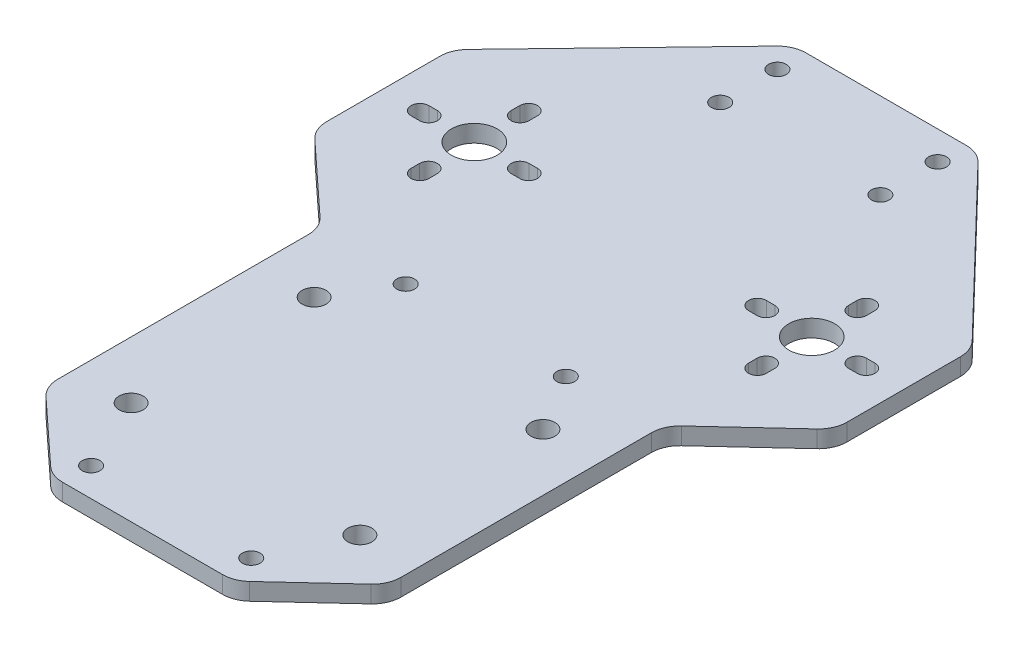
from build123d import *

# Parameters (mm, degrees)
SKETCH1_W           = 91
SKETCH1_H           = 130
SKETCH1_R           = 1.55
SKETCH1_R_2         = 2.1
SKETCH1_R_3         = 4
EXTRUDE_1_DEPTH     = 3
CUT_EXTRUDE_1_REACH = 100.669
FILLET_1_R          = 5


with BuildPart() as part:
    # Sketch1 → 凸台-拉伸1 (new body)
    with BuildSketch(Plane(origin=(0, 0, 0), x_dir=(1, 0, 0), z_dir=(0, 1, 0))):
        with Locations((0, -22.5)):
            Rectangle(SKETCH1_W, SKETCH1_H)
        with Locations((-14, -82.5)):
            Circle(SKETCH1_R, mode=Mode.SUBTRACT)
        with Locations((-20, -69.5)):
            Circle(SKETCH1_R_2, mode=Mode.SUBTRACT)
        with Locations((-20, -37.5)):
            Circle(SKETCH1_R_2, mode=Mode.SUBTRACT)
        with Locations((-14, -27.5)):
            Circle(SKETCH1_R, mode=Mode.SUBTRACT)
        with Locations((14, -82.5)):
            Circle(SKETCH1_R, mode=Mode.SUBTRACT)
        with Locations((20, -69.5)):
            Circle(SKETCH1_R_2, mode=Mode.SUBTRACT)
        with Locations((20, -37.5)):
            Circle(SKETCH1_R_2, mode=Mode.SUBTRACT)
        with Locations((14, -27.5)):
            Circle(SKETCH1_R, mode=Mode.SUBTRACT)
        with BuildLine():
            Line((-31.05, -9.5), (-31.05, -8))
            ThreePointArc((-31.05, -8), (-29.5, -6.45), (-27.95, -8))
            Line((-27.95, -8), (-27.95, -9.5))
            ThreePointArc((-27.95, -9.5), (-29.5, -11.05), (-31.05, -9.5))
        make_face(mode=Mode.SUBTRACT)
        with BuildLine():
            Line((-39, 1.55), (-37.5, 1.55))
            ThreePointArc((-37.5, 1.55), (-35.95, 0), (-37.5, -1.55))
            Line((-37.5, -1.55), (-39, -1.55))
            ThreePointArc((-39, -1.55), (-40.55, 0), (-39, 1.55))
        make_face(mode=Mode.SUBTRACT)
        with Locations((-29.5, 0)):
            Circle(SKETCH1_R_3, mode=Mode.SUBTRACT)
        with BuildLine():
            Line((-27.95, 9.5), (-27.95, 8))
            ThreePointArc((-27.95, 8), (-29.5, 6.45), (-31.05, 8))
            Line((-31.05, 8), (-31.05, 9.5))
            ThreePointArc((-31.05, 9.5), (-29.5, 11.05), (-27.95, 9.5))
        make_face(mode=Mode.SUBTRACT)
        with BuildLine():
            Line((-20, -1.55), (-21.5, -1.55))
            ThreePointArc((-21.5, -1.55), (-23.05, 0), (-21.5, 1.55))
            Line((-21.5, 1.55), (-20, 1.55))
            ThreePointArc((-20, 1.55), (-18.45, 0), (-20, -1.55))
        make_face(mode=Mode.SUBTRACT)
        with Locations((-14, 27.5)):
            Circle(SKETCH1_R, mode=Mode.SUBTRACT)
        with Locations((-14, 37.5)):
            Circle(SKETCH1_R, mode=Mode.SUBTRACT)
        with BuildLine():
            ThreePointArc((21.5, 1.55), (23.05, 0), (21.5, -1.55))
            Line((21.5, -1.55), (20, -1.55))
            ThreePointArc((20, -1.55), (18.45, 0), (20, 1.55))
            Line((20, 1.55), (21.5, 1.55))
        make_face(mode=Mode.SUBTRACT)
        with BuildLine():
            ThreePointArc((27.95, -8), (29.5, -6.45), (31.05, -8))
            Line((31.05, -8), (31.05, -9.5))
            ThreePointArc((31.05, -9.5), (29.5, -11.05), (27.95, -9.5))
            Line((27.95, -9.5), (27.95, -8))
        make_face(mode=Mode.SUBTRACT)
        with Locations((29.5, 0)):
            Circle(SKETCH1_R_3, mode=Mode.SUBTRACT)
        with BuildLine():
            ThreePointArc((31.05, 8), (29.5, 6.45), (27.95, 8))
            Line((27.95, 8), (27.95, 9.5))
            ThreePointArc((27.95, 9.5), (29.5, 11.05), (31.05, 9.5))
            Line((31.05, 9.5), (31.05, 8))
        make_face(mode=Mode.SUBTRACT)
        with BuildLine():
            ThreePointArc((37.5, -1.55), (35.95, 0), (37.5, 1.55))
            Line((37.5, 1.55), (39, 1.55))
            ThreePointArc((39, 1.55), (40.55, 0), (39, -1.55))
            Line((39, -1.55), (37.5, -1.55))
        make_face(mode=Mode.SUBTRACT)
        with Locations((14, 27.5)):
            Circle(SKETCH1_R, mode=Mode.SUBTRACT)
        with Locations((14, 37.5)):
            Circle(SKETCH1_R, mode=Mode.SUBTRACT)
    extrude(amount=EXTRUDE_1_DEPTH)

    # 草图8 → 切除-拉伸1 (cut, up to next)
    with BuildSketch(Plane(origin=(0, 0, 0), x_dir=(1, 0, 0), z_dir=(0, 1, 0)), mode=Mode.PRIVATE) as cut_extrude_1_sk1:
        Polygon((45.5, 12), (45.5, 42.5), (16.126379294, 42.5), align=None)
    cut_extrude_1_tool1 = extrude(cut_extrude_1_sk1.sketch, amount=CUT_EXTRUDE_1_REACH, mode=Mode.PRIVATE) & part.part
    # 草图8 → 切除-拉伸1 (cut, up to next)
    with BuildSketch(Plane(origin=(0, 0, 0), x_dir=(1, 0, 0), z_dir=(0, 1, 0)), mode=Mode.PRIVATE) as cut_extrude_1_sk2:
        Polygon((45.5, -87.5), (45.5, -12), (30, -26.351109147), (30, -74.5), (15.959273396, -87.5), align=None)
    cut_extrude_1_tool2 = extrude(cut_extrude_1_sk2.sketch, amount=CUT_EXTRUDE_1_REACH, mode=Mode.PRIVATE) & part.part
    # 草图8 → 切除-拉伸1 (cut, up to next)
    with BuildSketch(Plane(origin=(0, 0, 0), x_dir=(1, 0, 0), z_dir=(0, 1, 0)), mode=Mode.PRIVATE) as cut_extrude_1_sk3:
        Polygon((-45.5, -12), (-45.5, -87.5), (-15.959273396, -87.5), (-30, -74.5), (-30, -26.351109147), align=None)
    cut_extrude_1_tool3 = extrude(cut_extrude_1_sk3.sketch, amount=CUT_EXTRUDE_1_REACH, mode=Mode.PRIVATE) & part.part
    # 草图8 → 切除-拉伸1 (cut, up to next)
    with BuildSketch(Plane(origin=(0, 0, 0), x_dir=(1, 0, 0), z_dir=(0, 1, 0)), mode=Mode.PRIVATE) as cut_extrude_1_sk4:
        Polygon((-45.5, 12), (-16.126379294, 42.5), (-45.5, 42.5), align=None)
    cut_extrude_1_tool4 = extrude(cut_extrude_1_sk4.sketch, amount=CUT_EXTRUDE_1_REACH, mode=Mode.PRIVATE) & part.part
    add(cut_extrude_1_tool1.solids().sort_by_distance((35.708793, 0, -32.333333))[0], mode=Mode.SUBTRACT)
    add(cut_extrude_1_tool2.solids().sort_by_distance((37.013561, 0, 55.588779))[0], mode=Mode.SUBTRACT)
    add(cut_extrude_1_tool3.solids().sort_by_distance((-37.013561, 0, 55.588779))[0], mode=Mode.SUBTRACT)
    add(cut_extrude_1_tool4.solids().sort_by_distance((-35.708793, 0, -32.333333))[0], mode=Mode.SUBTRACT)

    # 圆角1
    fillet_1_edges = [part.edges().sort_by_distance(p)[0] for p in [
        (-45.5, 1.5, 12),
        (-45.5, 1.5, -12),
        (-16.126379294, 1.5, -42.5),
        (45.5, 1.5, -12),
        (45.5, 1.5, 12),
        (30, 1.5, 26.351109147),
        (30, 1.5, 74.5),
        (15.959273396, 1.5, 87.5),
        (-15.959273396, 1.5, 87.5),
        (-30, 1.5, 74.5),
        (-30, 1.5, 26.351109147),
        (16.126379294, 1.5, -42.5),
    ]]
    fillet(fillet_1_edges, radius=FILLET_1_R)


solid = part.part
